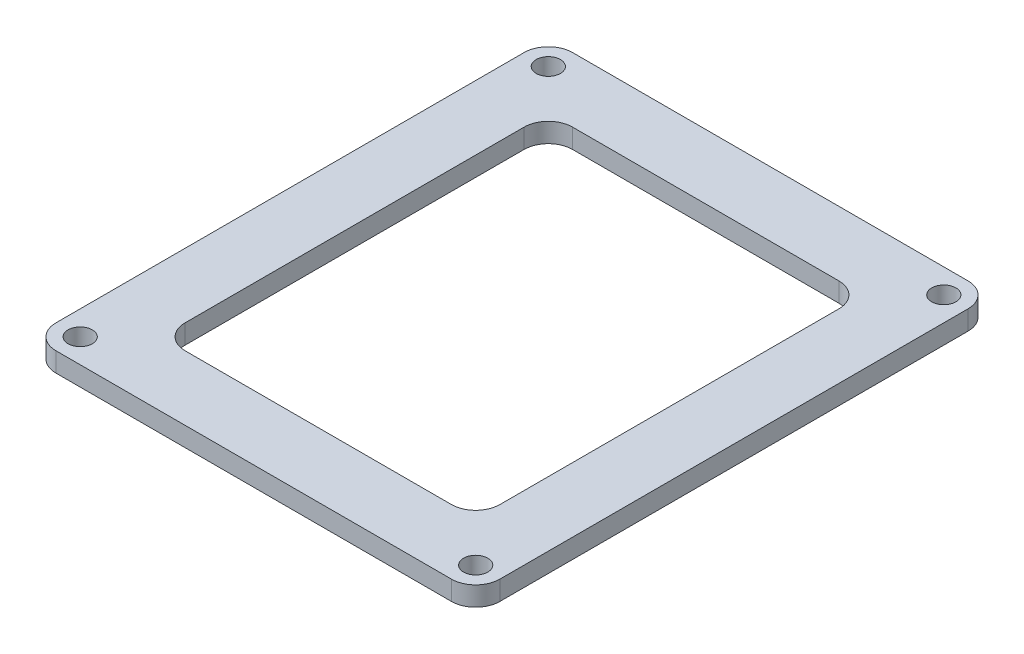
from build123d import *

# Parameters (mm, degrees)
SKETCH_1_W      = 55
SKETCH_1_H      = 64
SKETCH_1_R      = 1.5
SKETCH_1_W_2    = 39
SKETCH_1_H_2    = 48
EXTRUDE_1_DEPTH = 2.4
FILLET_1_R      = 3


with BuildPart() as part:
    # 草图1 → 凸台-拉伸1 (new body)
    with BuildSketch(Plane(origin=(0, 0, 0), x_dir=(1, 0, 0), z_dir=(0, 1, 0))):
        Rectangle(SKETCH_1_W, SKETCH_1_H)
        with Locations((-24.5, 29)):
            Circle(SKETCH_1_R, mode=Mode.SUBTRACT)
        with Locations((24.5, 29)):
            Circle(SKETCH_1_R, mode=Mode.SUBTRACT)
        with Locations((24.5, -29)):
            Circle(SKETCH_1_R, mode=Mode.SUBTRACT)
        with Locations((-24.5, -29)):
            Circle(SKETCH_1_R, mode=Mode.SUBTRACT)
        Rectangle(SKETCH_1_W_2, SKETCH_1_H_2, mode=Mode.SUBTRACT)
    extrude(amount=EXTRUDE_1_DEPTH)

    # 圆角1
    fillet_1_edges = [part.edges().sort_by_distance(p)[0] for p in [
        (-27.5, 1.2, -32),
        (27.5, 1.2, -32),
        (27.5, 1.2, 32),
        (-27.5, 1.2, 32),
        (-19.5, 1.2, 24),
        (19.5, 1.2, 24),
        (19.5, 1.2, -24),
        (-19.5, 1.2, -24),
    ]]
    fillet(fillet_1_edges, radius=FILLET_1_R)


solid = part.part
